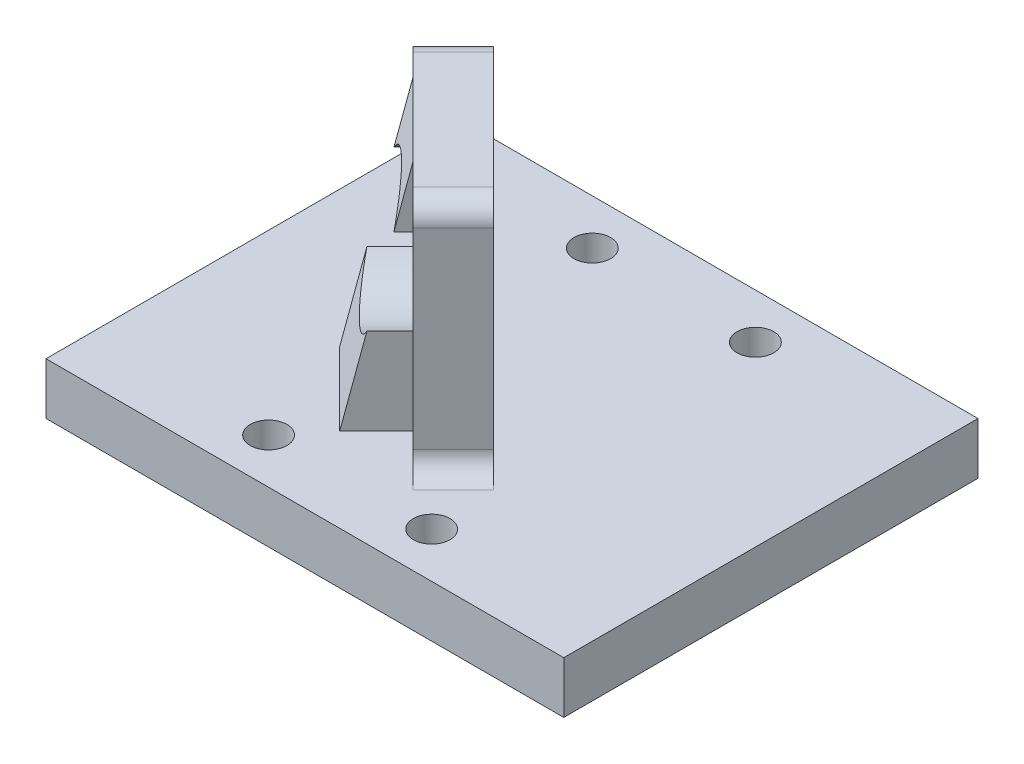
from build123d import *

# Parameters (mm, degrees)
SKETCH1_W           = 63.5
SKETCH1_H           = 50.8
BOSS_EXTRUDE1_DEPTH = 6.35
BOSS_EXTRUDE2_DEPTH = 28.575
SKETCH4_R           = 2.25
CUT_EXTRUDE2_DEPTH  = 50.6966108
FILLET1_R           = 2.54
SKETCH5_R           = 5.08
CUT_EXTRUDE3_DEPTH  = 55.806967537
BOSS_EXTRUDE3_DEPTH = 6.35
SKETCH7_R           = 8.255
CUT_EXTRUDE4_DEPTH  = 61.338925607


with BuildPart() as part:
    # Sketch1 → Boss-Extrude1 (new body)
    with BuildSketch(Plane(origin=(0, 0, 0), x_dir=(1, 0, 0), z_dir=(0, 1, 0))):
        Rectangle(SKETCH1_W, SKETCH1_H)
    extrude(amount=BOSS_EXTRUDE1_DEPTH)

    # Sketch2 → Boss-Extrude2 (add)
    with BuildSketch(Plane(origin=(0, 6.35, 0), x_dir=(1, 0, 0), z_dir=(0, 1, 0))):
        Polygon((2.907968577, -15.052543666), (-15.052543666, 2.907968577), (-10.102788136, 7.857724106), (7.857724106, -10.102788136), align=None)
    extrude(amount=BOSS_EXTRUDE2_DEPTH)

    # Sketch4 → Cut-Extrude2 (cut, through all)
    with BuildSketch(Plane(origin=(0, 6.35, 0), x_dir=(1, 0, 0), z_dir=(0, 1, 0))):
        with Locations((10, -19.85)):
            Circle(SKETCH4_R)
        with Locations((10, 19.85)):
            Circle(SKETCH4_R)
        with Locations((-10, 19.85)):
            Circle(SKETCH4_R)
        with Locations((-10, -19.85)):
            Circle(SKETCH4_R)
    extrude(amount=-CUT_EXTRUDE2_DEPTH, mode=Mode.SUBTRACT)

    # Fillet1
    fillet1_edges = [part.edges().sort_by_distance(p)[0] for p in [
        (-12.577665901, 6.35, -5.382846341),
        (-12.577665901, 34.925, -5.382846341),
        (5.382846341, 34.925, 12.577665901),
        (5.382846341, 6.35, 12.577665901),
    ]]
    fillet(fillet1_edges, radius=FILLET1_R)

    # Sketch5 → Cut-Extrude3 (cut, through all)
    with BuildSketch(Plane(origin=(-1.122532015, 0, 1.122532015), x_dir=(-0.7071067811865462, 0, -0.7071067811865488), z_dir=(0.7071067811865488, 0, -0.7071067811865462))):
        with Locations((0, 22.225)):
            Circle(SKETCH5_R)
    extrude(amount=-CUT_EXTRUDE3_DEPTH, mode=Mode.SUBTRACT)

    # Sketch6 → Boss-Extrude3 (add, symmetric)
    with BuildSketch(Plane(origin=(0, 0, 0), x_dir=(-0.707106781186549, 0, 0.7071067811865461), z_dir=(-0.7071067811865461, 0, -0.707106781186549))):
        Polygon((8.5875114, 34.925), (14.9375114, 6.35), (8.5875114, 6.35), align=None)
    extrude(amount=BOSS_EXTRUDE3_DEPTH, both=True)

    # Sketch7 → Cut-Extrude4 (cut, through all)
    with BuildSketch(Plane(origin=(-6.072287544, 0, 6.072287544), x_dir=(0.7071067811865464, 0, 0.7071067811865488), z_dir=(-0.7071067811865488, 0, 0.7071067811865464))):
        with Locations((0, 22.225)):
            Circle(SKETCH7_R)
    extrude(amount=CUT_EXTRUDE4_DEPTH, mode=Mode.SUBTRACT)


solid = part.part
